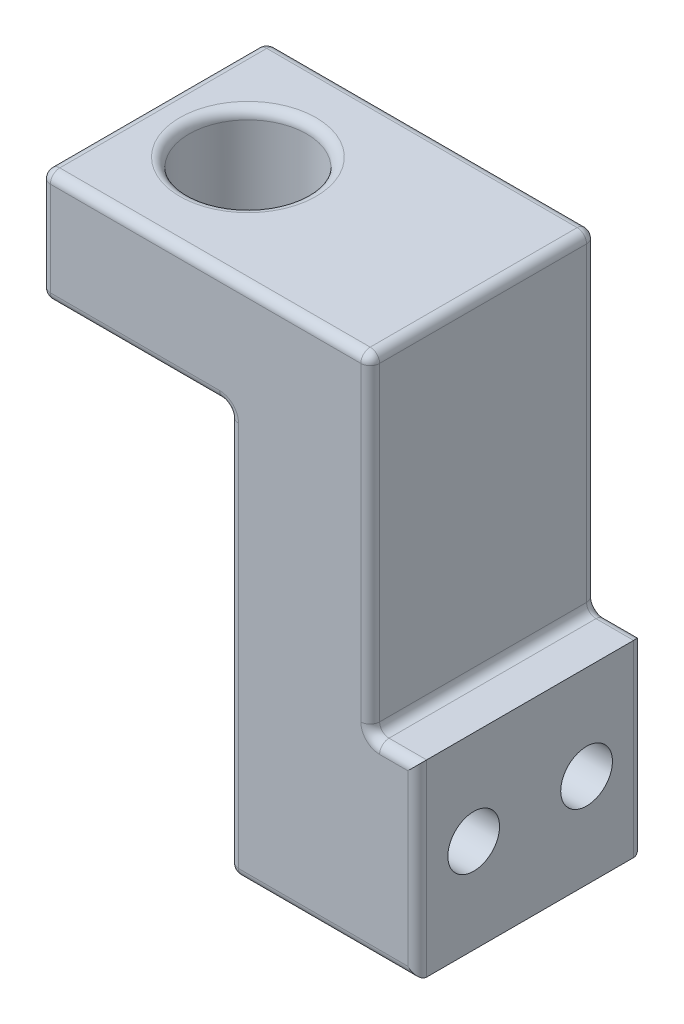
from build123d import *

# Parameters (mm, degrees)
SKETCH4_W           = 40
SKETCH4_H           = 24
BOSS_EXTRUDE2_DEPTH = 55
SKETCH6_W           = 5
SKETCH6_H           = 35
SKETCH6_W_2         = 20
SKETCH6_H_2         = 43
CUT_EXTRUDE1_DEPTH  = 73.117958928
SKETCH7_R           = 6.25
CUT_EXTRUDE2_DEPTH  = 64.442887702
SKETCH10_R          = 2.75
CUT_EXTRUDE4_DEPTH  = 64.253458403
SKETCH12_R          = 4.5
CUT_EXTRUDE5_DEPTH  = 8
FILLET1_R           = 1
FILLET2_R           = 1


with BuildPart() as part:
    # Sketch4 → Boss-Extrude2 (new body)
    with BuildSketch(Plane(origin=(0, 0, 0), x_dir=(1, 0, 0), z_dir=(0, 1, 0))):
        with Locations((20, 12)):
            Rectangle(SKETCH4_W, SKETCH4_H)
    extrude(amount=BOSS_EXTRUDE2_DEPTH)

    # Sketch6 → Cut-Extrude1 (cut, through all)
    with BuildSketch(Plane.XY):
        with Locations((37.5, 37.5)):
            Rectangle(SKETCH6_W, SKETCH6_H)
        with Locations((10, 21.5)):
            Rectangle(SKETCH6_W_2, SKETCH6_H_2)
    extrude(amount=-CUT_EXTRUDE1_DEPTH, mode=Mode.SUBTRACT)

    # Sketch7 → Cut-Extrude2 (cut, through all)
    with BuildSketch(Plane(origin=(0, 43, 0), x_dir=(-1, 0, 0), z_dir=(0, -1, 0))):
        with Locations(Location((-10, 12, 0), (0, 0, 90))):
            Circle(SKETCH7_R)
    extrude(amount=-CUT_EXTRUDE2_DEPTH, mode=Mode.SUBTRACT)

    # Sketch10 → Cut-Extrude4 (cut, through all)
    with BuildSketch(Plane.ZY.offset(-20)):
        with Locations((-18, 10)):
            Circle(SKETCH10_R)
        with Locations((-6, 10)):
            Circle(SKETCH10_R)
    extrude(amount=-CUT_EXTRUDE4_DEPTH, mode=Mode.SUBTRACT)

    # Sketch12 → Cut-Extrude5 (cut)
    with BuildSketch(Plane.ZY.offset(-20)):
        with Locations((-18, 10)):
            Circle(SKETCH12_R)
        with Locations((-6, 10)):
            Circle(SKETCH12_R)
    extrude(amount=-CUT_EXTRUDE5_DEPTH, mode=Mode.SUBTRACT)

    # Fillet1
    # the kernel refuses this fillet: 1 mm, written as the material it adds along each edge
    with BuildSketch(Plane(origin=(35, 20, 0), x_dir=(1, 0, 0), z_dir=(0, 0, -1)), Plane(origin=(20, 43, 0), x_dir=(-1, 0, 0), z_dir=(0, 0, -1))) as fillet1_piece_1:
        with BuildLine():
            CenterArc((FILLET1_R, -FILLET1_R), FILLET1_R, 90, 90)
            Line((0, -FILLET1_R), (0, 0))
            Line((0, 0), (FILLET1_R, 0))
        make_face()
    extrude(amount=24)
    # the kernel refuses this fillet: 1 mm, written as the material it takes off along each edge
    with BuildSketch(Plane(origin=(21, 1, -1), x_dir=(-1, 0, 0), z_dir=(0, 0, 1))) as fillet1_2_piece_1_section:
        Polygon((0, 0), (FILLET1_R, 0), (FILLET1_R, FILLET1_R), (0, FILLET1_R), align=None)
    fillet1_2_piece_1 = extrude(amount=FILLET1_R, mode=Mode.PRIVATE)
    fillet1_2_piece_1 = fillet1_2_piece_1 - Plane(origin=(21, 1, -1), x_dir=(0.7071067811865475, 0.7071067811865475, 0), z_dir=(0, 0, 1)) * Sphere(FILLET1_R, mode=Mode.PRIVATE)
    add(fillet1_2_piece_1, mode=Mode.SUBTRACT)
    with BuildSketch(Plane(origin=(34, 54, -23), x_dir=(1, 0, 0), z_dir=(0, 0, -1))) as fillet1_2_piece_2_section:
        Polygon((0, 0), (FILLET1_R, 0), (FILLET1_R, -FILLET1_R), (0, -FILLET1_R), align=None)
    fillet1_2_piece_2 = extrude(amount=FILLET1_R, mode=Mode.PRIVATE)
    fillet1_2_piece_2 = fillet1_2_piece_2 - Plane(origin=(34, 54, -23), x_dir=(-0.7071067811865475, -0.7071067811865477, 0), z_dir=(0, 0, -1)) * Sphere(FILLET1_R, mode=Mode.PRIVATE)
    add(fillet1_2_piece_2, mode=Mode.SUBTRACT)
    with BuildSketch(Plane(origin=(1, 54, -23), x_dir=(0, 0, -1), z_dir=(-1, 0, 0))) as fillet1_2_piece_3_section:
        Polygon((0, 0), (FILLET1_R, 0), (FILLET1_R, -FILLET1_R), (0, -FILLET1_R), align=None)
    fillet1_2_piece_3 = extrude(amount=FILLET1_R, mode=Mode.PRIVATE)
    fillet1_2_piece_3 = fillet1_2_piece_3 - Plane(origin=(1, 54, -23), x_dir=(0, -0.7071067811865475, 0.7071067811865475), z_dir=(-1, 0, 0)) * Sphere(FILLET1_R, mode=Mode.PRIVATE)
    add(fillet1_2_piece_3, mode=Mode.SUBTRACT)
    with BuildSketch(Plane(origin=(34, 54, -1), x_dir=(1, 0, 0), z_dir=(0, 0, 1))) as fillet1_2_piece_4_section:
        Polygon((0, 0), (FILLET1_R, 0), (FILLET1_R, FILLET1_R), (0, FILLET1_R), align=None)
    fillet1_2_piece_4 = extrude(amount=FILLET1_R, mode=Mode.PRIVATE)
    fillet1_2_piece_4 = fillet1_2_piece_4 - Plane(origin=(34, 54, -1), x_dir=(-0.7071067811865475, -0.7071067811865477, 0), z_dir=(0, 0, 1)) * Sphere(FILLET1_R, mode=Mode.PRIVATE)
    add(fillet1_2_piece_4, mode=Mode.SUBTRACT)
    with BuildSketch(Plane(origin=(21, 1, -23), x_dir=(-1, 0, 0), z_dir=(0, -1, 0))) as fillet1_2_piece_5_section:
        Polygon((0, 0), (FILLET1_R, 0), (FILLET1_R, FILLET1_R), (0, FILLET1_R), align=None)
    fillet1_2_piece_5 = extrude(amount=FILLET1_R, mode=Mode.PRIVATE)
    fillet1_2_piece_5 = fillet1_2_piece_5 - Plane(origin=(21, 1, -23), x_dir=(0.7071067811865475, 0, 0.7071067811865475), z_dir=(0, -1, 0)) * Sphere(FILLET1_R, mode=Mode.PRIVATE)
    add(fillet1_2_piece_5, mode=Mode.SUBTRACT)
    with BuildSketch(Plane(origin=(1, 44, -23), x_dir=(0, -1, 0), z_dir=(-1, 0, 0))) as fillet1_2_piece_6_section:
        Polygon((0, 0), (FILLET1_R, 0), (FILLET1_R, -FILLET1_R), (0, -FILLET1_R), align=None)
    fillet1_2_piece_6 = extrude(amount=FILLET1_R, mode=Mode.PRIVATE)
    fillet1_2_piece_6 = fillet1_2_piece_6 - Plane(origin=(1, 44, -23), x_dir=(0, 0.7071067811865475, 0.7071067811865475), z_dir=(-1, 0, 0)) * Sphere(FILLET1_R, mode=Mode.PRIVATE)
    add(fillet1_2_piece_6, mode=Mode.SUBTRACT)
    with BuildSketch(Plane(origin=(1, 44, -1), x_dir=(0, -1, 0), z_dir=(-1, 0, 0))) as fillet1_2_piece_7_section:
        Polygon((0, 0), (FILLET1_R, 0), (FILLET1_R, FILLET1_R), (0, FILLET1_R), align=None)
    fillet1_2_piece_7 = extrude(amount=FILLET1_R, mode=Mode.PRIVATE)
    fillet1_2_piece_7 = fillet1_2_piece_7 - Plane(origin=(1, 44, -1), x_dir=(0, 0.7071067811865475, -0.7071067811865475), z_dir=(-1, 0, 0)) * Sphere(FILLET1_R, mode=Mode.PRIVATE)
    add(fillet1_2_piece_7, mode=Mode.SUBTRACT)
    with BuildSketch(Plane(origin=(1, 54, -1), x_dir=(0, 0, 1), z_dir=(-1, 0, 0))) as fillet1_2_piece_8_section:
        Polygon((0, 0), (FILLET1_R, 0), (FILLET1_R, FILLET1_R), (0, FILLET1_R), align=None)
    fillet1_2_piece_8 = extrude(amount=FILLET1_R, mode=Mode.PRIVATE)
    fillet1_2_piece_8 = fillet1_2_piece_8 - Plane(origin=(1, 54, -1), x_dir=(0, -0.7071067811865475, -0.7071067811865475), z_dir=(-1, 0, 0)) * Sphere(FILLET1_R, mode=Mode.PRIVATE)
    add(fillet1_2_piece_8, mode=Mode.SUBTRACT)
    with BuildSketch(Plane(origin=(21, 0, 0), x_dir=(0, 1, 0), z_dir=(1, 0, 0))) as fillet1_2_piece_9:
        with BuildLine():
            CenterArc((FILLET1_R, -FILLET1_R), FILLET1_R, 90, 90)
            Line((0, -FILLET1_R), (0, 0))
            Line((0, 0), (FILLET1_R, 0))
        make_face()
    extrude(amount=21.5, mode=Mode.SUBTRACT)
    with BuildSketch(Plane(origin=(34, 55, -24), x_dir=(0, 0, 1), z_dir=(-1, 0, 0))) as fillet1_2_piece_10:
        with BuildLine():
            CenterArc((FILLET1_R, -FILLET1_R), FILLET1_R, 90, 90)
            Line((0, -FILLET1_R), (0, 0))
            Line((0, 0), (FILLET1_R, 0))
        make_face()
    extrude(amount=33, mode=Mode.SUBTRACT)
    with BuildSketch(Plane(origin=(40, -2.5, -24), x_dir=(0, 0, 1), z_dir=(0, 1, 0)), Plane(origin=(40, -2.5, 0), x_dir=(-1, 0, 0), z_dir=(0, 1, 0))) as fillet1_2_piece_11:
        with BuildLine():
            CenterArc((FILLET1_R, -FILLET1_R), FILLET1_R, 90, 90)
            Line((0, -FILLET1_R), (0, 0))
            Line((0, 0), (FILLET1_R, 0))
        make_face()
    extrude(amount=25, mode=Mode.SUBTRACT)
    with BuildSketch(Plane(origin=(35, 54, -24), x_dir=(0, 0, 1), z_dir=(0, -1, 0)), Plane(origin=(35, 54, 0), x_dir=(-1, 0, 0), z_dir=(0, -1, 0)), Plane(origin=(1, 55, 0), x_dir=(0, -1, 0), z_dir=(1, 0, 0))) as fillet1_2_piece_12:
        with BuildLine():
            CenterArc((FILLET1_R, FILLET1_R), FILLET1_R, 180, 90)
            Line((0, FILLET1_R), (0, 0))
            Line((0, 0), (FILLET1_R, 0))
        make_face()
    extrude(amount=33, mode=Mode.SUBTRACT)
    with BuildSketch(Plane(origin=(35, 55, -1), x_dir=(0, -1, 0), z_dir=(0, 0, -1)), Plane(origin=(20, 0, -1), x_dir=(0, 1, 0), z_dir=(0, 0, -1))) as fillet1_2_piece_13:
        with BuildLine():
            CenterArc((FILLET1_R, FILLET1_R), FILLET1_R, 180, 90)
            Line((0, FILLET1_R), (0, 0))
            Line((0, 0), (FILLET1_R, 0))
        make_face()
    extrude(amount=22, mode=Mode.SUBTRACT)
    with BuildSketch(Plane(origin=(36, 20, -24), x_dir=(0, 0, 1), z_dir=(1, 0, 0)), Plane(origin=(36, 20, 0), x_dir=(0, -1, 0), z_dir=(1, 0, 0))) as fillet1_2_piece_14:
        with BuildLine():
            CenterArc((FILLET1_R, FILLET1_R), FILLET1_R, 180, 90)
            Line((0, FILLET1_R), (0, 0))
            Line((0, 0), (FILLET1_R, 0))
        make_face()
    extrude(amount=6.5, mode=Mode.SUBTRACT)
    with BuildSketch(Plane(origin=(20, 1, -24), x_dir=(0, 0, 1), z_dir=(0, 1, 0)), Plane(origin=(20, 1, 0), x_dir=(1, 0, 0), z_dir=(0, 1, 0))) as fillet1_2_piece_15:
        with BuildLine():
            CenterArc((FILLET1_R, FILLET1_R), FILLET1_R, 180, 90)
            Line((0, FILLET1_R), (0, 0))
            Line((0, 0), (FILLET1_R, 0))
        make_face()
    extrude(amount=41, mode=Mode.SUBTRACT)
    with BuildSketch(Plane(origin=(19, 43, -24), x_dir=(0, 0, 1), z_dir=(-1, 0, 0)), Plane(origin=(19, 43, 0), x_dir=(0, 1, 0), z_dir=(-1, 0, 0))) as fillet1_2_piece_16:
        with BuildLine():
            CenterArc((FILLET1_R, FILLET1_R), FILLET1_R, 180, 90)
            Line((0, FILLET1_R), (0, 0))
            Line((0, 0), (FILLET1_R, 0))
        make_face()
    extrude(amount=18, mode=Mode.SUBTRACT)
    with BuildSketch(Plane(origin=(0, 43, -1), x_dir=(1, 0, 0), z_dir=(0, 0, -1)), Plane(origin=(0, 55, -23), x_dir=(1, 0, 0), z_dir=(0, 0, 1))) as fillet1_2_piece_17:
        with BuildLine():
            CenterArc((FILLET1_R, -FILLET1_R), FILLET1_R, 90, 90)
            Line((0, -FILLET1_R), (0, 0))
            Line((0, 0), (FILLET1_R, 0))
        make_face()
    extrude(amount=22, mode=Mode.SUBTRACT)
    with BuildSketch(Plane(origin=(10, 55, -12), x_dir=(0, 0, -1), z_dir=(-1, 0, 0))) as fillet1_2_piece_18:
        with BuildLine():
            CenterArc((6.25 + FILLET1_R, FILLET1_R), FILLET1_R, 180, 90)
            Line((6.25, FILLET1_R), (6.25, 0))
            Line((6.25, 0), (6.25 + FILLET1_R, 0))
        make_face()
    revolve(axis=Axis((10, 55, -12), (0, -1, 0)), mode=Mode.SUBTRACT)
    with BuildSketch(Plane(origin=(42.5, 0, -24), x_dir=(0, 0, 1), z_dir=(-1, 0, 0))) as fillet1_2_piece_19:
        with BuildLine():
            CenterArc((FILLET1_R, FILLET1_R), FILLET1_R, 180, 90)
            Line((0, FILLET1_R), (0, 0))
            Line((0, 0), (FILLET1_R, 0))
        make_face()
    extrude(amount=21.5, mode=Mode.SUBTRACT)
    with BuildSketch(Plane(origin=(20, 10, -18), x_dir=(0, 0, 1), z_dir=(0, -1, 0))) as fillet1_2_piece_20:
        with BuildLine():
            CenterArc((4.5 + FILLET1_R, -FILLET1_R), FILLET1_R, 90, 90)
            Line((4.5, -FILLET1_R), (4.5, 0))
            Line((4.5, 0), (4.5 + FILLET1_R, 0))
        make_face()
    revolve(axis=Axis((20, 10, -18), (-1, 0, 0)), mode=Mode.SUBTRACT)
    with BuildSketch(Plane(origin=(20, 10, -6), x_dir=(0, 0, 1), z_dir=(0, -1, 0))) as fillet1_2_piece_21:
        with BuildLine():
            CenterArc((4.5 + FILLET1_R, -FILLET1_R), FILLET1_R, 90, 90)
            Line((4.5, -FILLET1_R), (4.5, 0))
            Line((4.5, 0), (4.5 + FILLET1_R, 0))
        make_face()
    revolve(axis=Axis((20, 10, -6), (-1, 0, 0)), mode=Mode.SUBTRACT)
    with BuildSketch(Plane(origin=(0, 44, -24), x_dir=(0, 0, 1), z_dir=(0, 1, 0)), Plane(origin=(0, 44, 0), x_dir=(1, 0, 0), z_dir=(0, 1, 0))) as fillet1_2_piece_22:
        with BuildLine():
            CenterArc((FILLET1_R, FILLET1_R), FILLET1_R, 180, 90)
            Line((0, FILLET1_R), (0, 0))
            Line((0, 0), (FILLET1_R, 0))
        make_face()
    extrude(amount=10, mode=Mode.SUBTRACT)
    with BuildSketch(Plane(origin=(19, 42, 0), x_dir=(0, 1, 0), z_dir=(-1, 0, 0))) as fillet1_2_piece_23:
        with BuildLine():
            CenterArc((1 + FILLET1_R, FILLET1_R), FILLET1_R, 180, 90)
            Line((1, FILLET1_R), (1, 0))
            Line((1, 0), (1 + FILLET1_R, 0))
        make_face()
    revolve(axis=Axis((19, 42, 0), (0, 0, -1)), revolution_arc=90, mode=Mode.SUBTRACT)
    with BuildSketch(Plane(origin=(19, 42, -24), x_dir=(0, 1, 0), z_dir=(-1, 0, 0))) as fillet1_2_piece_24:
        with BuildLine():
            CenterArc((1 + FILLET1_R, -FILLET1_R), FILLET1_R, 90, 90)
            Line((1 + FILLET1_R, 0), (1, 0))
            Line((1, 0), (1, -FILLET1_R))
        make_face()
    revolve(axis=Axis((19, 42, -24), (0, 0, -1)), revolution_arc=90, mode=Mode.SUBTRACT)
    with BuildSketch(Plane(origin=(36, 21, 0), x_dir=(0, -1, 0), z_dir=(1, 0, 0))) as fillet1_2_piece_25:
        with BuildLine():
            CenterArc((1 + FILLET1_R, FILLET1_R), FILLET1_R, 180, 90)
            Line((1, FILLET1_R), (1, 0))
            Line((1, 0), (1 + FILLET1_R, 0))
        make_face()
    revolve(axis=Axis((36, 21, 0), (0, 0, -1)), revolution_arc=90, mode=Mode.SUBTRACT)
    with BuildSketch(Plane(origin=(36, 21, -24), x_dir=(0, -1, 0), z_dir=(1, 0, 0))) as fillet1_2_piece_26:
        with BuildLine():
            CenterArc((1 + FILLET1_R, -FILLET1_R), FILLET1_R, 90, 90)
            Line((1, -FILLET1_R), (1, 0))
            Line((1, 0), (1 + FILLET1_R, 0))
        make_face()
    revolve(axis=Axis((36, 21, -24), (0, 0, -1)), revolution_arc=90, mode=Mode.SUBTRACT)

    # Fillet2
    fillet2_edges = [part.edges().sort_by_distance(p)[0] for p in [
        (10, 43, -5.75),
    ]]
    fillet(fillet2_edges, radius=FILLET2_R)


solid = part.part
